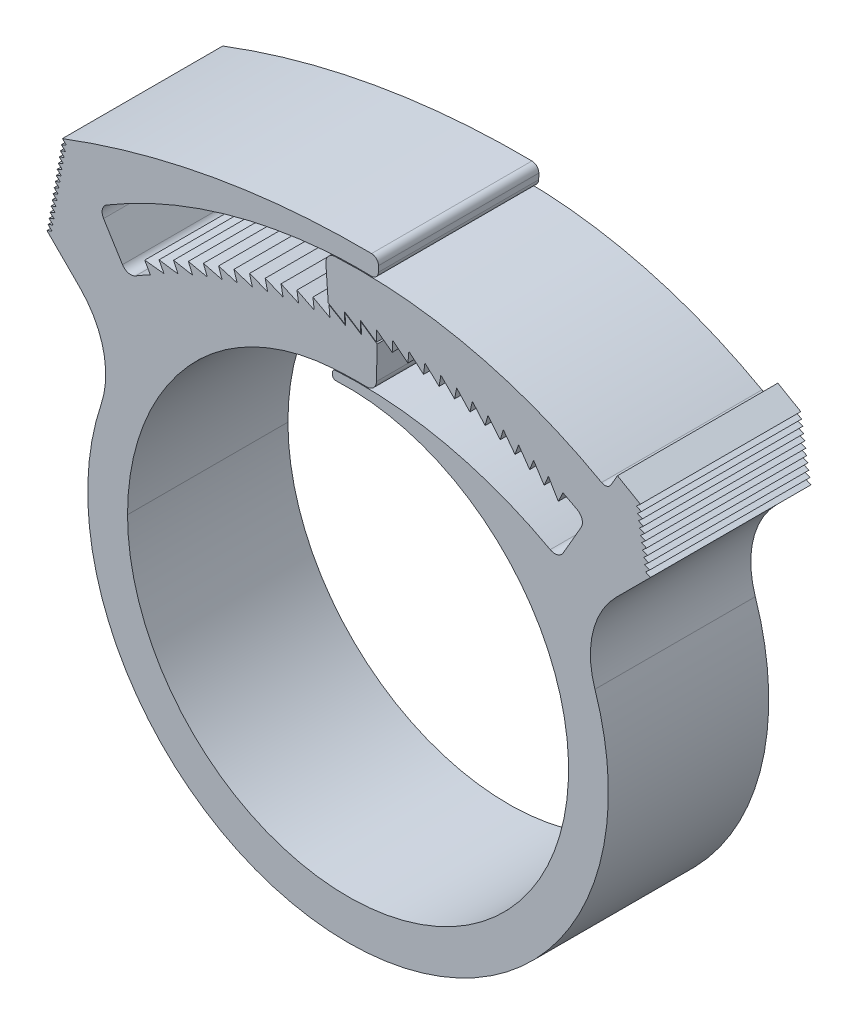
from build123d import *

# Parameters (mm, degrees)
BOSS_EXTRUDE1_DEPTH = 3.175
BOSS_EXTRUDE2_DEPTH = 3.175
CRVPATTERN14_START  = -3.175
CRVPATTERN14_DEPTH  = 6.35
BOSS_EXTRUDE3_DEPTH = 3.175
BOSS_EXTRUDE4_DEPTH = 3.175
CRVPATTERN15_START  = -3.175
CRVPATTERN15_DEPTH  = 6.35
BOSS_EXTRUDE6_DEPTH = 3.175
BOSS_EXTRUDE5_DEPTH = 3.175
FILLET1_R           = 3.4925
CUT_EXTRUDE1_DEPTH  = 19.540349169
LPATTERN1_COUNT     = 10
LPATTERN1_PITCH     = 0.234080142
CUT_EXTRUDE2_DEPTH  = 19.540349169
LPATTERN2_COUNT     = 15
LPATTERN2_PITCH     = 0.234080142
FILLET2_R           = 0.381992187
FILLET3_R           = 0.275034375
FILLET4_R           = 0.1397


# Read off the part's stored shape, not the designer's step: CrvPattern14, CrvPattern15
with BuildPart() as part:
    # Sketch2 → Boss-Extrude1 (new, symmetric)
    with BuildSketch(Plane.XY):
        with BuildLine():
            Line((-0.609061211, 8.709981114), (-0.63342366, 9.058380358))
            ThreePointArc((-0.63342366, 9.058380358), (4.002589765, 8.693518189), (8.329356078, 6.989159613))
            Line((8.329356078, 6.989159613), (9.420762328, 8.87953069))
            ThreePointArc((9.420762328, 8.87953069), (4.493615739, 10.820385346), (-0.785688963, 11.235875637))
            Line((-0.785688963, 11.235875637), (-0.904666302, 12.937330857))
            ThreePointArc((-0.904666302, 12.937330857), (5.256215716, 12.39082562), (10.940813072, 9.953513965))
            Line((10.940813072, 9.953513965), (11.358270628, 7.585994515))
            Line((11.358270628, 7.585994515), (8.925301113, 5.153025))
            ThreePointArc((8.925301113, 5.153025), (0, -10.30605), (-8.925301113, 5.153025))
            Line((-8.925301113, 5.153025), (-7.63821797, 4.409927201))
            ThreePointArc((-7.63821797, 4.409927201), (-8.45391938, 2.271683128), (-8.73125, 0))
            ThreePointArc((-8.73125, 0), (6.385632007, -5.954698181), (-0.609061211, 8.709981114))
        make_face()
    extrude(amount=BOSS_EXTRUDE1_DEPTH, both=True)

    # Sketch3 → Boss-Extrude2 (add, symmetric)
    with BuildSketch(Plane.XY):
        Polygon((-0.785688963, 11.235875637), (-0.124836135, 10.84326625), (-0.146982388, 11.269093252), (-0.604480928, 11.540890865), align=None)
    extrude(amount=BOSS_EXTRUDE2_DEPTH, both=True)

    # CrvPattern14 outline → CrvPattern14 (add)
    with BuildSketch(Plane.XY.offset(CRVPATTERN14_START)):
        with BuildLine():
            ThreePointArc((8.508949493, 9.371373735), (8.221945597, 9.512438565), (7.932469228, 9.648357493))
            Line((7.932469228, 9.648357493), (8.324283845, 8.987033143))
            Line((8.324283845, 8.987033143), (8.508949493, 9.371373735))
        make_face()
        with BuildLine():
            ThreePointArc((7.932469228, 9.648357493), (7.640612644, 9.779087203), (7.346468857, 9.90458603))
            Line((7.346468857, 9.90458603), (7.76164113, 9.257669826))
            Line((7.76164113, 9.257669826), (7.932469228, 9.648357493))
        make_face()
        with BuildLine():
            ThreePointArc((7.346468857, 9.90458603), (7.050131611, 10.024813979), (6.751695348, 10.139732733))
            Line((6.751695348, 10.139732733), (7.189696061, 9.508049295))
            Line((7.189696061, 9.508049295), (7.346468857, 9.90458603))
        make_face()
        with BuildLine():
            ThreePointArc((6.751695348, 10.139732733), (6.45125518, 10.249305668), (6.148906855, 10.353497863))
            Line((6.148906855, 10.353497863), (6.609177691, 9.737852391))
            Line((6.609177691, 9.737852391), (6.751695348, 10.139732733))
        make_face()
        with BuildLine():
            ThreePointArc((6.148906855, 10.353497863), (5.844746732, 10.452276113), (5.538871745, 10.545608936))
            Line((5.538871745, 10.545608936), (6.020826003, 9.946786187))
            Line((6.020826003, 9.946786187), (6.148906855, 10.353497863))
        make_face()
        with BuildLine():
            ThreePointArc((5.538871745, 10.545608936), (5.231379378, 10.633466588), (4.922367627, 10.715821068))
            Line((4.922367627, 10.715821068), (5.425390963, 10.134584358))
            Line((5.425390963, 10.134584358), (5.538871745, 10.545608936))
        make_face()
        with BuildLine():
            ThreePointArc((4.922367627, 10.715821068), (4.611934973, 10.792646132), (4.30018035, 10.863917293))
            Line((4.30018035, 10.863917293), (4.823631565, 10.301007517))
            Line((4.823631565, 10.301007517), (4.922367627, 10.715821068))
        make_face()
        with BuildLine():
            ThreePointArc((4.30018035, 10.863917293), (3.987203115, 10.92961184), (3.673103013, 10.989708834))
            Line((3.673103013, 10.989708834), (4.216314869, 10.445843528))
            Line((4.216314869, 10.445843528), (4.30018035, 10.863917293))
        make_face()
        with BuildLine():
            ThreePointArc((3.673103013, 10.989708834), (3.357980146, 11.044189123), (3.041934944, 11.093035344))
            Line((3.041934944, 11.093035344), (3.604215013, 10.56890777))
            Line((3.604215013, 10.56890777), (3.673103013, 10.989708834))
        make_face()
        with BuildLine():
            ThreePointArc((3.041934944, 11.093035344), (2.72506813, 11.136231931), (2.407480688, 11.173765115))
            Line((2.407480688, 11.173765115), (2.988112238, 10.670043372))
            Line((2.988112238, 10.670043372), (3.041934944, 11.093035344))
        make_face()
        with BuildLine():
            ThreePointArc((2.407480688, 11.173765115), (2.089273834, 11.205622937), (1.770548979, 11.231795242))
            Line((1.770548979, 11.231795242), (2.368791882, 10.74912142))
            Line((2.368791882, 10.74912142), (2.407480688, 11.173765115))
        make_face()
        with BuildLine():
            ThreePointArc((1.770548979, 11.231795242), (1.4514077, 11.252273689), (1.131951706, 11.267051753))
            Line((1.131951706, 11.267051753), (1.747043389, 10.806041112))
            Line((1.747043389, 10.806041112), (1.770548979, 11.231795242))
        make_face()
        with BuildLine():
            ThreePointArc((1.131951706, 11.267051753), (0.812282808, 11.276124723), (0.492502884, 11.279489708))
            Line((0.492502884, 11.279489708), (1.123659295, 10.840729894))
            Line((1.123659295, 10.840729894), (1.131951706, 11.267051753))
        make_face()
        with BuildLine():
            Line((-0.146982388, 11.269093252), (0.499434223, 10.853143547))
            Line((0.499434223, 10.853143547), (0.492502884, 11.279489708))
            ThreePointArc((0.492502884, 11.279489708), (0.172713846, 11.277145635), (-0.146982388, 11.269093252))
        make_face()
    extrude(amount=CRVPATTERN14_DEPTH)

    # Sketch6 → Boss-Extrude3 (add, symmetric)
    with BuildSketch(Plane.XY):
        with BuildLine():
            Line((-10.592779775, 6.820503663), (-8.925301113, 5.153025))
            Line((-8.925301113, 5.153025), (-7.63821797, 4.409927201))
            ThreePointArc((-7.63821797, 4.409927201), (-7.033595471, 5.40172099), (-6.311775509, 6.311775509))
            ThreePointArc((-6.311775509, 6.311775509), (-3.7432277, 8.250144087), (-0.635195474, 9.083718485))
            ThreePointArc((-0.635195474, 9.083718485), (0.240619235, 9.120517791), (1.117125058, 9.108553832))
            Line((1.117125058, 9.108553832), (1.14938794, 10.767223776))
            ThreePointArc((1.14938794, 10.767223776), (-5.084482558, 9.873216056), (-10.592779775, 6.820503663))
        make_face()
    extrude(amount=BOSS_EXTRUDE3_DEPTH, both=True)

    # Sketch7 → Boss-Extrude4 (add, symmetric)
    with BuildSketch(Plane.XY):
        Polygon((1.149861702, 10.791580382), (0.51870529, 11.230340197), (0.525602375, 10.806100973), (0.530574879, 10.500242627), (1.144388979, 10.510221733), align=None)
    extrude(amount=BOSS_EXTRUDE4_DEPTH, both=True)

    # CrvPattern15 outline → CrvPattern15 (add)
    with BuildSketch(Plane.XY.offset(CRVPATTERN15_START)):
        with BuildLine():
            Line((-8.050612153, 9.07082228), (-7.828635543, 8.679621643))
            ThreePointArc((-7.828635543, 8.679621643), (-3.783273531, 10.25487562), (0.526016811, 10.780609059))
            Line((0.526016811, 10.780609059), (0.525602375, 10.806100973))
            Line((0.525602375, 10.806100973), (-0.119042185, 11.220910416))
            Line((-0.119042185, 11.220910416), (-0.097005376, 10.797187785))
            Line((-0.097005376, 10.797187785), (-0.756046579, 11.188720895))
            Line((-0.756046579, 11.188720895), (-0.718898135, 10.766054973))
            Line((-0.718898135, 10.766054973), (-1.391495907, 11.133812666))
            Line((-1.391495907, 11.133812666), (-1.339283183, 10.71274222))
            Line((-1.339283183, 10.71274222), (-2.024580169, 11.056255718))
            Line((-2.024580169, 11.056255718), (-1.957369718, 10.637317484))
            Line((-1.957369718, 10.637317484), (-2.654492378, 10.956148914))
            Line((-2.654492378, 10.956148914), (-2.572369873, 10.539876908))
            Line((-2.572369873, 10.539876908), (-3.28042959, 10.833619859))
            Line((-3.28042959, 10.833619859), (-3.183499713, 10.420544699))
            Line((-3.183499713, 10.420544699), (-3.901593929, 10.688824739))
            Line((-3.901593929, 10.688824739), (-3.789980234, 10.279472968))
            Line((-3.789980234, 10.279472968), (-4.517193603, 10.521948123))
            Line((-4.517193603, 10.521948123), (-4.391038364, 10.116841539))
            Line((-4.391038364, 10.116841539), (-5.126443911, 10.333202727))
            Line((-5.126443911, 10.333202727), (-4.985907937, 9.932857715))
            Line((-4.985907937, 9.932857715), (-5.72856825, 10.122829144))
            Line((-5.72856825, 10.122829144), (-5.573830679, 9.727756021))
            Line((-5.573830679, 9.727756021), (-6.322799095, 9.891095535))
            Line((-6.322799095, 9.891095535), (-6.154057172, 9.501797895))
            Line((-6.154057172, 9.501797895), (-6.908378986, 9.638297288))
            Line((-6.908378986, 9.638297288), (-6.725847804, 9.255271367))
            Line((-6.725847804, 9.255271367), (-7.48456149, 9.364756643))
            Line((-7.48456149, 9.364756643), (-7.28847372, 8.98849068))
            Line((-7.28847372, 8.98849068), (-8.050612153, 9.07082228))
        make_face()
    extrude(amount=CRVPATTERN15_DEPTH)

    # Sketch15 → Boss-Extrude6 (add, symmetric)
    with BuildSketch(Plane.XY):
        with BuildLine():
            Line((10.273567328, 10.356632279), (10.666473578, 11.037165866))
            Line((10.666473578, 11.037165866), (11.347007165, 10.644259616))
            Line((11.347007165, 10.644259616), (11.573851695, 10.513290866))
            Line((11.573851695, 10.513290866), (11.980327595, 8.208051482))
            Line((11.980327595, 8.208051482), (11.358270628, 7.585994515))
            Line((11.358270628, 7.585994515), (10.940813072, 9.953513965))
            ThreePointArc((10.940813072, 9.953513965), (10.609192613, 10.158387538), (10.273567328, 10.356632279))
        make_face()
    extrude(amount=BOSS_EXTRUDE6_DEPTH, both=True)

    # Sketch14 → Boss-Extrude5 (add, symmetric)
    with BuildSketch(Plane.XY):
        with BuildLine():
            Line((-8.731282847, 8.155251387), (-9.883822332, 10.008983607))
            ThreePointArc((-9.883822332, 10.008983607), (-5.572003499, 12.023412105), (-0.906438116, 12.962668983))
            ThreePointArc((-0.906438116, 12.962668983), (0.142618823, 13.012964807), (1.192759308, 12.99699312))
            Line((1.192759308, 12.99699312), (1.2080413, 13.782657009))
            ThreePointArc((1.2080413, 13.782657009), (-5.156235576, 13.296025051), (-11.311506568, 11.606803381))
            Line((-11.311506568, 11.606803381), (-11.921220418, 8.148944306))
            Line((-11.921220418, 8.148944306), (-8.925301113, 5.153025))
            Line((-8.925301113, 5.153025), (-8.731282847, 8.155251387))
        make_face()
    extrude(amount=BOSS_EXTRUDE5_DEPTH, both=True)

    # Fillet1
    fillet1_edges = [part.edges().sort_by_distance(p)[0] for p in [
        (8.925301113, 5.153025, 0),
        (-8.925301113, 5.153025, 0),
    ]]
    fillet(fillet1_edges, radius=FILLET1_R)

    # Sketch16 → Cut-Extrude1 (cut, symmetric)
    with BuildSketch(Plane.XY):
        Polygon((11.573851695, 10.513290866), (11.413250439, 10.366126929), (11.614499285, 10.282766928), align=None)
    cut_extrude1 = extrude(amount=CUT_EXTRUDE1_DEPTH, both=True, mode=Mode.SUBTRACT)

    # LPattern1: Cut-Extrude1 ×10
    with Locations(*[Vector(0.17364817766693025, -0.9848077530122081, 0) * (i * LPATTERN1_PITCH) for i in range(1, LPATTERN1_COUNT)]):
        add(cut_extrude1, mode=Mode.SUBTRACT)

    # Sketch17 → Cut-Extrude2 (cut, symmetric)
    with BuildSketch(Plane.XY):
        Polygon((-11.311506568, 11.606803381), (-11.150905312, 11.459639444), (-11.352154158, 11.376279443), align=None)
    cut_extrude2 = extrude(amount=CUT_EXTRUDE2_DEPTH, both=True, mode=Mode.SUBTRACT)

    # LPattern2: Cut-Extrude2 ×15
    with Locations(*[Vector(-0.17364817766692994, -0.9848077530122081, 0) * (i * LPATTERN2_PITCH) for i in range(1, LPATTERN2_COUNT)]):
        add(cut_extrude2, mode=Mode.SUBTRACT)

    # Fillet2
    fillet2_edges = [part.edges().sort_by_distance(p)[0] for p in [
        (8.329356078, 6.989159613, 0),
        (9.420762328, 8.87953069, 0),
        (-0.904666302, 12.937330857, 0),
        (1.117125058, 9.108553832, 0),
        (-8.731282847, 8.155251387, 0),
        (-9.883822332, 10.008983607, 0),
    ]]
    fillet(fillet2_edges, radius=FILLET2_R)

    # Fillet3
    fillet3_edges = [part.edges().sort_by_distance(p)[0] for p in [
        (10.273567328, 10.356632279, 0),
        (1.192759308, 12.99699312, 0),
        (1.2080413, 13.782657009, 0),
    ]]
    fillet(fillet3_edges, radius=FILLET3_R)

    # Fillet4
    fillet4_edges = [part.edges().sort_by_distance(p)[0] for p in [
        (-0.609061211, 8.709981114, 0),
        (-0.63342366, 9.058380358, 0),
    ]]
    fillet(fillet4_edges, radius=FILLET4_R)


solid = part.part
